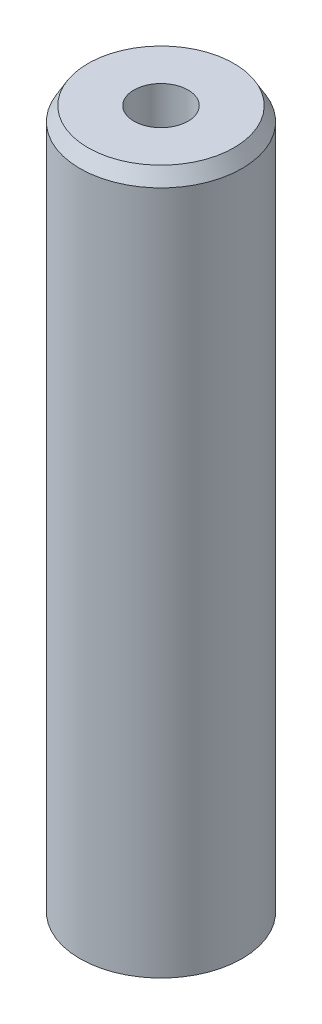
from build123d import *
from OCP.BRepFilletAPI import BRepFilletAPI_MakeChamfer

# Parameters (mm, degrees)
SKETCH1_R           = 5
BOSS_EXTRUDE1_DEPTH = 43.563955917
SKETCH2_R           = 1.669690723
CUT_EXTRUDE1_DEPTH  = 45.134094022
CHAMFER1_SIZE       = 0.862020226
CHAMFER1_SIZE2      = 0.49768761


with BuildPart() as part:
    # Sketch1 → Boss-Extrude1 (new body)
    with BuildSketch(Plane(origin=(0, 0, 0), x_dir=(1, 0, 0), z_dir=(0, 1, 0))):
        Circle(SKETCH1_R)
    extrude(amount=BOSS_EXTRUDE1_DEPTH)

    # Sketch2 → Cut-Extrude1 (cut, through all)
    with BuildSketch(Plane(origin=(0, 0, 0), x_dir=(1, 0, 0), z_dir=(0, 1, 0))):
        Circle(SKETCH2_R)
    extrude(amount=CUT_EXTRUDE1_DEPTH, mode=Mode.SUBTRACT)

    # Chamfer1: one chamfer whose edges measure the first distance from different faces: ONE call of the kernel's chamfer builder (chamfer() names one face for all edges)
    chamfer1_edges_1 = [part.edges().sort_by_distance(p)[0] for p in [
        (-5, 43.563955917, 0),
    ]]
    chamfer1_side_1 = [part.faces().sort_by_distance(p)[0] for p in [
        (-5, 21.781977959, 0),
    ]]
    chamfer1_edges_2 = [part.edges().sort_by_distance(p)[0] for p in [
        (-5, 0, 0),
    ]]
    chamfer1_side_2 = [part.faces().sort_by_distance(p)[0] for p in [
        (-4.858578644, 0, 0),
    ]]
    chamfer1 = BRepFilletAPI_MakeChamfer(part.part.solid().wrapped)
    for e in chamfer1_edges_1:
        chamfer1.Add(CHAMFER1_SIZE, CHAMFER1_SIZE2, e.wrapped, chamfer1_side_1[0].wrapped)  # the first distance lies on this face
    for e in chamfer1_edges_2:
        chamfer1.Add(CHAMFER1_SIZE, CHAMFER1_SIZE2, e.wrapped, chamfer1_side_2[0].wrapped)  # the first distance lies on this face
    add(Compound.cast(chamfer1.Shape()), mode=Mode.REPLACE)


solid = part.part
